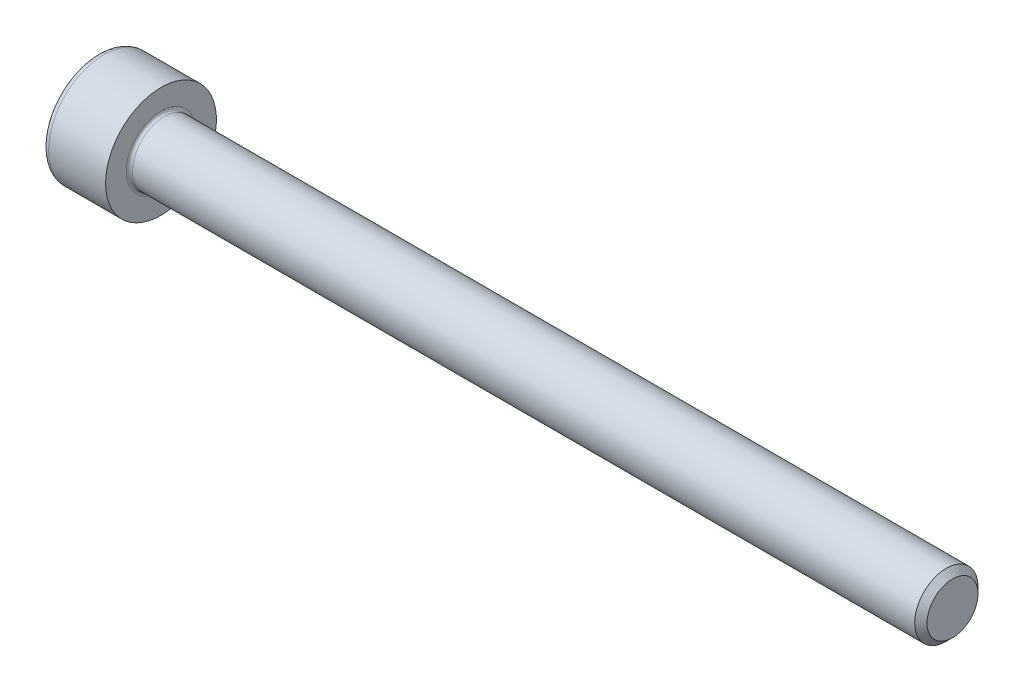
from build123d import *

# Parameters (mm, degrees)
FILLET1_R   = 0.2
FILLET2_R   = 0.4
HEX_2_DEPTH = 2


with BuildPart() as part:
    # BodySke → Base-Revolve (revolve)
    with BuildSketch(Plane.XY):
        Polygon((0, 0), (0, 3.5), (4, 3.5), (4, 2), (53.61, 2), (54, 1.61), (54, 0), align=None)
    revolve(axis=Axis((-31.75, 0, 0), (1, 0, 0)))

    # Fillet1
    fillet1_edges = [part.edges().sort_by_distance(p)[0] for p in [
        (4, -2, 0),
    ]]
    fillet(fillet1_edges, radius=FILLET1_R)

    # Fillet2
    fillet2_edges = [part.edges().sort_by_distance(p)[0] for p in [
        (0, -3.5, 0),
    ]]
    fillet(fillet2_edges, radius=FILLET2_R)

    # Sketch2 → Hex-PreBroach (revolve, cut)
    with BuildSketch(Plane.XY):
        Polygon((0, 1.51), (2, 1.51), (2.871798906, 0), (0, 0), align=None)
    revolve(axis=Axis((0, 0, 0), (1, 0, 0)), mode=Mode.SUBTRACT)

    # Sketch3 → Hex 2 (cut)
    with BuildSketch(Plane(origin=(0, 0, 0), x_dir=(0, 0.500000000000001, 0.866025403784438), z_dir=(-1, 0, 0))):
        Polygon((0.871798906, 1.51), (-0.871798906, 1.51), (-1.743597813, 0), (-0.871798906, -1.51), (0.871798906, -1.51), (1.743597813, 0), align=None)
    extrude(amount=-HEX_2_DEPTH, mode=Mode.SUBTRACT)


solid = part.part
